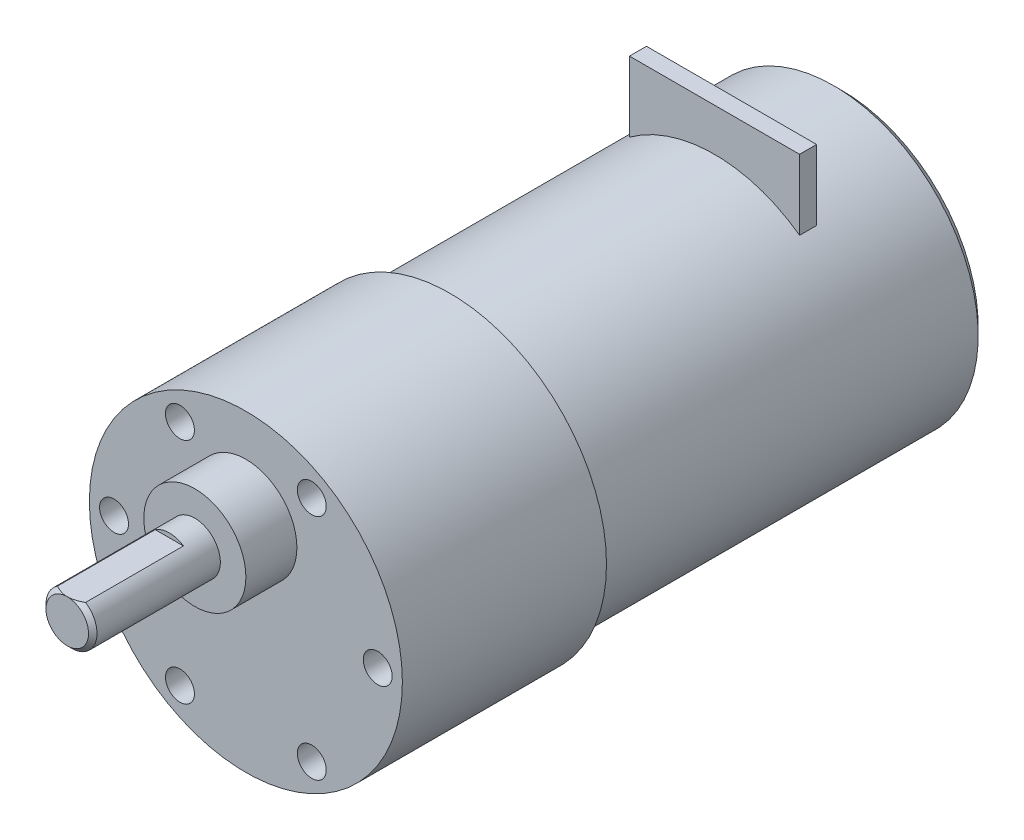
from build123d import *

# Parameters (mm, degrees)
SKETCH2_R           = 18.4
BOSS_EXTRUDE1_DEPTH = 24
SKETCH3_R           = 17
BOSS_EXTRUDE2_DEPTH = 46.1
CHAMFER1_SIZE       = 1
SKETCH6_R           = 6
BOSS_EXTRUDE5_DEPTH = 6
SKETCH7_R           = 3
BOSS_EXTRUDE6_DEPTH = 15
CUT_EXTRUDE1_DEPTH  = 12
CHAMFER2_SIZE       = 0.5
CIRPATTERN1_COUNT   = 6
SKETCH11_W          = 20
SKETCH11_H          = 2
BOSS_EXTRUDE7_DEPTH = 22


with BuildPart() as part:
    # Sketch2 → Boss-Extrude1 (new body)
    with BuildSketch(Plane.XY):
        Circle(SKETCH2_R)
    extrude(amount=BOSS_EXTRUDE1_DEPTH)

    # Sketch3 → Boss-Extrude2 (add)
    with BuildSketch(Plane(origin=(0, 0, 0), x_dir=(-1, 0, 0), z_dir=(0, 0, -1))):
        Circle(SKETCH3_R)
    extrude(amount=BOSS_EXTRUDE2_DEPTH)

    # Chamfer1
    chamfer1_edges = [part.edges().sort_by_distance(p)[0] for p in [
        (17, 0, -46.1),
    ]]
    chamfer(chamfer1_edges, length=CHAMFER1_SIZE)

    # Sketch6 → Boss-Extrude5 (add)
    with BuildSketch(Plane.XY.offset(24)):
        with Locations((0, 7.5)):
            Circle(SKETCH6_R)
    extrude(amount=BOSS_EXTRUDE5_DEPTH)

    # Sketch7 → Boss-Extrude6 (add)
    with BuildSketch(Plane.XY.offset(30)):
        with Locations((0, 7.5)):
            Circle(SKETCH7_R)
    extrude(amount=BOSS_EXTRUDE6_DEPTH)

    # Sketch8 → Cut-Extrude1 (cut)
    with BuildSketch(Plane.XY.offset(45)):
        Polygon((-81.196672921, 10), (-1.658312395, 10), (1.658312395, 10), (81.196672921, 10), (81.196672921, 169.076721051), (-81.196672921, 169.076721051), align=None)
    extrude(amount=-CUT_EXTRUDE1_DEPTH, mode=Mode.SUBTRACT)

    # Chamfer2
    chamfer2_edges = [part.edges().sort_by_distance(p)[0] for p in [
        (-1.418637165, 4.856617963, 45),
    ]]
    chamfer(chamfer2_edges, length=CHAMFER2_SIZE - 0.0001)  # a hair under: the kernel refuses the full size

    # Sketch10 → M3 Clearance Hole1 (revolve, cut)
    with BuildSketch(Plane(origin=(-15.5, 0, 24), x_dir=(0, -1, 0), z_dir=(1, 0, 0))):
        Polygon((0, 0), (0, 4.521463052), (1.7, 3.5), (1.7, 0), align=None)
    m3_clearance_hole1 = revolve(axis=Axis((-15.5, 0, 30.35), (0, 0, -1)), mode=Mode.SUBTRACT)

    # CirPattern1: M3 Clearance Hole1 ×6 about axis
    cirpattern1_axis = Axis((0, 0, 0), (0, 0, 1))
    for i in range(1, CIRPATTERN1_COUNT):
        add(m3_clearance_hole1.rotate(cirpattern1_axis, i * 360 / CIRPATTERN1_COUNT), mode=Mode.SUBTRACT)

    # Sketch11 → Boss-Extrude7 (add)
    with BuildSketch(Plane(origin=(0, 0, 0), x_dir=(1, 0, 0), z_dir=(0, 1, 0))):
        with Locations((0, 32.1)):
            Rectangle(SKETCH11_W, SKETCH11_H)
    extrude(amount=BOSS_EXTRUDE7_DEPTH)


solid = part.part
